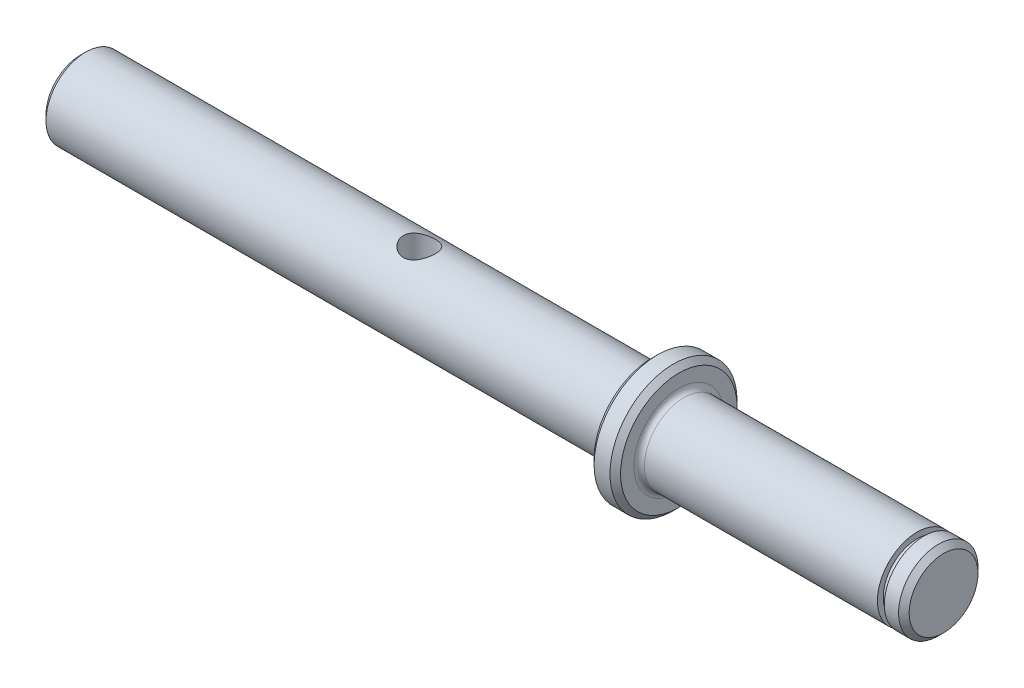
from build123d import *

# Parameters (mm, degrees)
CUT_EXTRUDE1_DEPTH      = 10
CUT_EXTRUDE1_DEPTH_BACK = 10
SKETCH2_R               = 3
CHAMFER1_SIZE           = 1
FILLET1_R               = 2
FILLET2_R               = 1


with BuildPart() as part:
    # Sketch1 → Revolve1 (revolve)
    with BuildSketch(Plane.XY):
        Polygon((0, 0), (0, 7.5), (108, 7.5), (108, 12), (113, 12), (113, 7.5), (158, 7.5), (158, 6.4), (159.3, 6.4), (159.3, 7.5), (163, 7.5), (163, 0), align=None)
    revolve(axis=Axis((0, 0, 0), (-1, 0, 0)))

    # Sketch2 → Cut-Extrude1 (cut, two sides: drawn at the far end of the back side and taken through both)
    with BuildSketch(Plane(origin=(0, 0, 0), x_dir=(1, 0, 0), z_dir=(0, 1, 0)).offset(-CUT_EXTRUDE1_DEPTH_BACK)):
        with Locations((64, 0)):
            Circle(SKETCH2_R)
    extrude(amount=CUT_EXTRUDE1_DEPTH + CUT_EXTRUDE1_DEPTH_BACK, mode=Mode.SUBTRACT)

    # Chamfer1
    chamfer1_edges = [part.edges().sort_by_distance(p)[0] for p in [
        (113, -12, 0),
        (108, -12, 0),
        (0, -7.5, 0),
        (163, -7.5, 0),
    ]]
    chamfer(chamfer1_edges, length=CHAMFER1_SIZE)

    # Fillet1
    fillet1_edges = [part.edges().sort_by_distance(p)[0] for p in [
        (108, -7.5, 0),
    ]]
    fillet(fillet1_edges, radius=FILLET1_R)

    # Fillet2
    fillet2_edges = [part.edges().sort_by_distance(p)[0] for p in [
        (113, -7.5, 0),
    ]]
    fillet(fillet2_edges, radius=FILLET2_R)


solid = part.part
